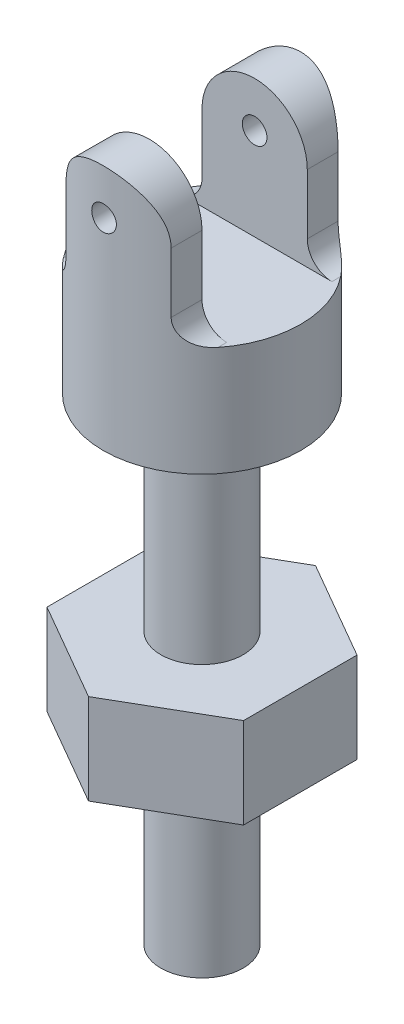
from build123d import *

# Parameters (mm, degrees)
SKETCH1_R               = 6
BOSS_EXTRUDE1_DEPTH     = 15
CUT_EXTRUDE1_DEPTH      = 18.23368794
CUT_EXTRUDE1_DEPTH_BACK = 18.23368794
SKETCH2_W               = 6.4
SKETCH2_H               = 8.35
CUT_EXTRUDE2_DEPTH      = 18.23368794
CUT_EXTRUDE2_DEPTH_BACK = 18.23368794
SKETCH3_R               = 0.75
SKETCH4_R               = 2.5
BOSS_EXTRUDE2_DEPTH     = 29
BOSS_EXTRUDE3_DEPTH     = 5.5


with BuildPart() as part:
    # Sketch1 → Boss-Extrude1 (new body)
    with BuildSketch(Plane(origin=(0, 0, 0), x_dir=(1, 0, 0), z_dir=(0, 1, 0))):
        Circle(SKETCH1_R)
    extrude(amount=BOSS_EXTRUDE1_DEPTH)

    # Sketch2 → Cut-Extrude1 (cut, two sides: drawn at the far end of the back side and taken through both)
    with BuildSketch(Plane(origin=(0, 0, 0), x_dir=(0, 0, -1), z_dir=(1, 0, 0)).offset(-CUT_EXTRUDE1_DEPTH_BACK)):
        with Locations((0, 10.825)):
            Rectangle(SKETCH2_W, SKETCH2_H)
    extrude(amount=CUT_EXTRUDE1_DEPTH + CUT_EXTRUDE1_DEPTH_BACK, mode=Mode.SUBTRACT)

    # Sketch3 → Cut-Extrude2 (cut, two sides: drawn at the far end of the back side and taken through both)
    with BuildSketch(Plane.XY.offset(-CUT_EXTRUDE2_DEPTH_BACK)):
        with BuildLine():
            Line((5.075431016, 15), (-1.9e-08, 15))
            ThreePointArc((-1.9e-08, 15), (2.262741693, 14.062741706), (3.2, 11.8))
            Line((3.2, 11.8), (3.2, 8.15))
            ThreePointArc((3.2, 8.15), (3.639339828, 7.089339828), (4.7, 6.65))
            Line((4.7, 6.65), (5.075431016, 6.65))
            Line((5.075431016, 6.65), (5.075431016, 15))
        make_face()
        with BuildLine():
            Line((-3.2, 8.15), (-3.2, 11.8))
            ThreePointArc((-3.2, 11.8), (-2.262741706, 14.062741693), (-1.9e-08, 15))
            Line((-1.9e-08, 15), (-5.075431016, 15))
            Line((-5.075431016, 15), (-5.075431016, 6.65))
            Line((-5.075431016, 6.65), (-4.7, 6.65))
            ThreePointArc((-4.7, 6.65), (-3.639339828, 7.089339828), (-3.2, 8.15))
        make_face()
        with Locations((0, 12.25)):
            Circle(SKETCH3_R)
    extrude(amount=CUT_EXTRUDE2_DEPTH + CUT_EXTRUDE2_DEPTH_BACK, mode=Mode.SUBTRACT)

    # Sketch4 → Boss-Extrude2 (add)
    with BuildSketch(Plane.XZ):
        Circle(SKETCH4_R)
    extrude(amount=BOSS_EXTRUDE2_DEPTH)

    # Sketch5 → Boss-Extrude3 (add)
    with BuildSketch(Plane(origin=(0, -18, 0), x_dir=(-1, 0, 0), z_dir=(0, -1, 0))):
        Polygon((0, -6.899335717), (5.975, -3.449667858), (5.975, 3.449667858), (0, 6.899335717), (-5.975, 3.449667858), (-5.975, -3.449667858), align=None)
    extrude(amount=-BOSS_EXTRUDE3_DEPTH)


solid = part.part
